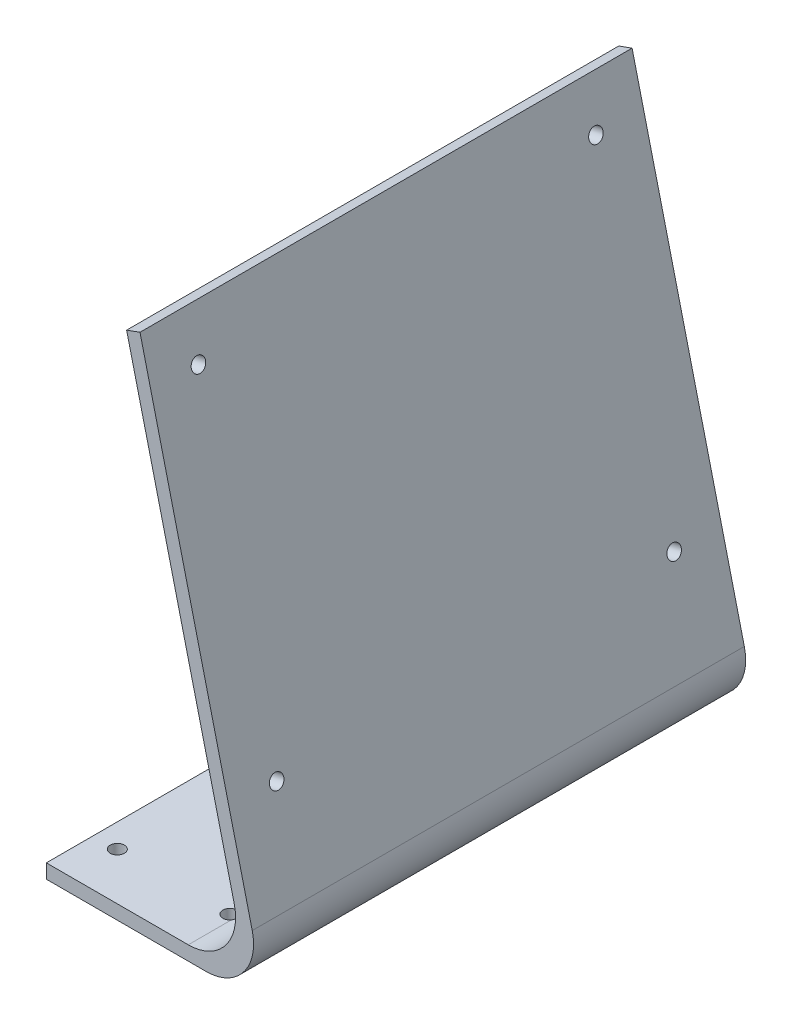
from build123d import *

# Parameters (mm, degrees)
BOSS_EXTRUDE1_DEPTH = 52
CUT_EXTRUDE_1_REACH = 133.119
SKETCH_2_R          = 1.5
CUT_EXTRUDE1_REACH  = 133.747
SKETCH2_R           = 1.5


with BuildPart() as part:
    # Sketch1 → Boss-Extrude1 (new, symmetric)
    with BuildSketch(Plane.XY):
        with BuildLine():
            Line((-50.530004832, 0), (-50.530004832, 3))
            Line((-50.530004832, 3), (-20.530004832, 3))
            ThreePointArc((-20.530004832, 3), (-12.668388321, 6.819790793), (-10.812717884, 15.361002831))
            Line((-10.812717884, 15.361002831), (-33.559523327, 108.981066609))
            Line((-33.559523327, 108.981066609), (-30.737861628, 110))
            Line((-30.737861628, 110), (-7.014578577, 12.361002831))
            ThreePointArc((-7.014578577, 12.361002831), (-8.870249014, 3.819790793), (-16.731865525, 0))
            Line((-16.731865525, 0), (-50.530004832, 0))
        make_face()
    extrude(amount=BOSS_EXTRUDE1_DEPTH, both=True)

    # Эскиз2 → Вырез-Вытянуть1 (cut, up to next)
    with BuildSketch(Plane(origin=(-3.787634246, -0.920279007, 0), x_dir=(0, 0, -1), z_dir=(0.9717286948053454, 0.23610028312541273, 0)), mode=Mode.PRIVATE) as cut_extrude_1_sk1:
        with Locations((-42, 104.147374262)):
            Circle(SKETCH_2_R)
    cut_extrude_1_tool1 = extrude(cut_extrude_1_sk1.sketch, amount=-CUT_EXTRUDE_1_REACH, mode=Mode.PRIVATE) & part.part
    # Эскиз2 → Вырез-Вытянуть1 (cut, up to next)
    with BuildSketch(Plane(origin=(-3.787634246, -0.920279007, 0), x_dir=(0, 0, -1), z_dir=(0.9717286948053454, 0.23610028312541273, 0)), mode=Mode.PRIVATE) as cut_extrude_1_sk2:
        with Locations((42, 104.147374262)):
            Circle(SKETCH_2_R)
    cut_extrude_1_tool2 = extrude(cut_extrude_1_sk2.sketch, amount=-CUT_EXTRUDE_1_REACH, mode=Mode.PRIVATE) & part.part
    # Эскиз2 → Вырез-Вытянуть1 (cut, up to next)
    with BuildSketch(Plane(origin=(-3.787634246, -0.920279007, 0), x_dir=(0, 0, -1), z_dir=(0.9717286948053454, 0.23610028312541273, 0)), mode=Mode.PRIVATE) as cut_extrude_1_sk3:
        with Locations((42, 34.147374262)):
            Circle(SKETCH_2_R)
    cut_extrude_1_tool3 = extrude(cut_extrude_1_sk3.sketch, amount=-CUT_EXTRUDE_1_REACH, mode=Mode.PRIVATE) & part.part
    # Эскиз2 → Вырез-Вытянуть1 (cut, up to next)
    with BuildSketch(Plane(origin=(-3.787634246, -0.920279007, 0), x_dir=(0, 0, -1), z_dir=(0.9717286948053454, 0.23610028312541273, 0)), mode=Mode.PRIVATE) as cut_extrude_1_sk4:
        with Locations((-42, 34.147374262)):
            Circle(SKETCH_2_R)
    cut_extrude_1_tool4 = extrude(cut_extrude_1_sk4.sketch, amount=-CUT_EXTRUDE_1_REACH, mode=Mode.PRIVATE) & part.part
    add(cut_extrude_1_tool1.solids().sort_by_distance((-28.376859, 100.282713, 42))[0], mode=Mode.SUBTRACT)
    add(cut_extrude_1_tool2.solids().sort_by_distance((-28.376859, 100.282713, -42))[0], mode=Mode.SUBTRACT)
    add(cut_extrude_1_tool3.solids().sort_by_distance((-11.849839, 32.261704, -42))[0], mode=Mode.SUBTRACT)
    add(cut_extrude_1_tool4.solids().sort_by_distance((-11.849839, 32.261704, 42))[0], mode=Mode.SUBTRACT)

    # Sketch2 → Cut-Extrude1 (cut, up to next)
    with BuildSketch(Plane.XZ, mode=Mode.PRIVATE) as cut_extrude1_sk1:
        with Locations((-45.530004832, 42)):
            Circle(SKETCH2_R)
    cut_extrude1_tool1 = extrude(cut_extrude1_sk1.sketch, amount=-CUT_EXTRUDE1_REACH, mode=Mode.PRIVATE) & part.part
    # Sketch2 → Cut-Extrude1 (cut, up to next)
    with BuildSketch(Plane.XZ, mode=Mode.PRIVATE) as cut_extrude1_sk2:
        with Locations((-21.730004832, 42)):
            Circle(SKETCH2_R)
    cut_extrude1_tool2 = extrude(cut_extrude1_sk2.sketch, amount=-CUT_EXTRUDE1_REACH, mode=Mode.PRIVATE) & part.part
    # Sketch2 → Cut-Extrude1 (cut, up to next)
    with BuildSketch(Plane.XZ, mode=Mode.PRIVATE) as cut_extrude1_sk3:
        with Locations((-21.730004832, -42)):
            Circle(SKETCH2_R)
    cut_extrude1_tool3 = extrude(cut_extrude1_sk3.sketch, amount=-CUT_EXTRUDE1_REACH, mode=Mode.PRIVATE) & part.part
    # Sketch2 → Cut-Extrude1 (cut, up to next)
    with BuildSketch(Plane.XZ, mode=Mode.PRIVATE) as cut_extrude1_sk4:
        with Locations((-45.530004832, -42)):
            Circle(SKETCH2_R)
    cut_extrude1_tool4 = extrude(cut_extrude1_sk4.sketch, amount=-CUT_EXTRUDE1_REACH, mode=Mode.PRIVATE) & part.part
    add(cut_extrude1_tool1.solids().sort_by_distance((-45.530005, 0, 42))[0], mode=Mode.SUBTRACT)
    add(cut_extrude1_tool2.solids().sort_by_distance((-21.730005, 0, 42))[0], mode=Mode.SUBTRACT)
    add(cut_extrude1_tool3.solids().sort_by_distance((-21.730005, 0, -42))[0], mode=Mode.SUBTRACT)
    add(cut_extrude1_tool4.solids().sort_by_distance((-45.530005, 0, -42))[0], mode=Mode.SUBTRACT)


solid = part.part
